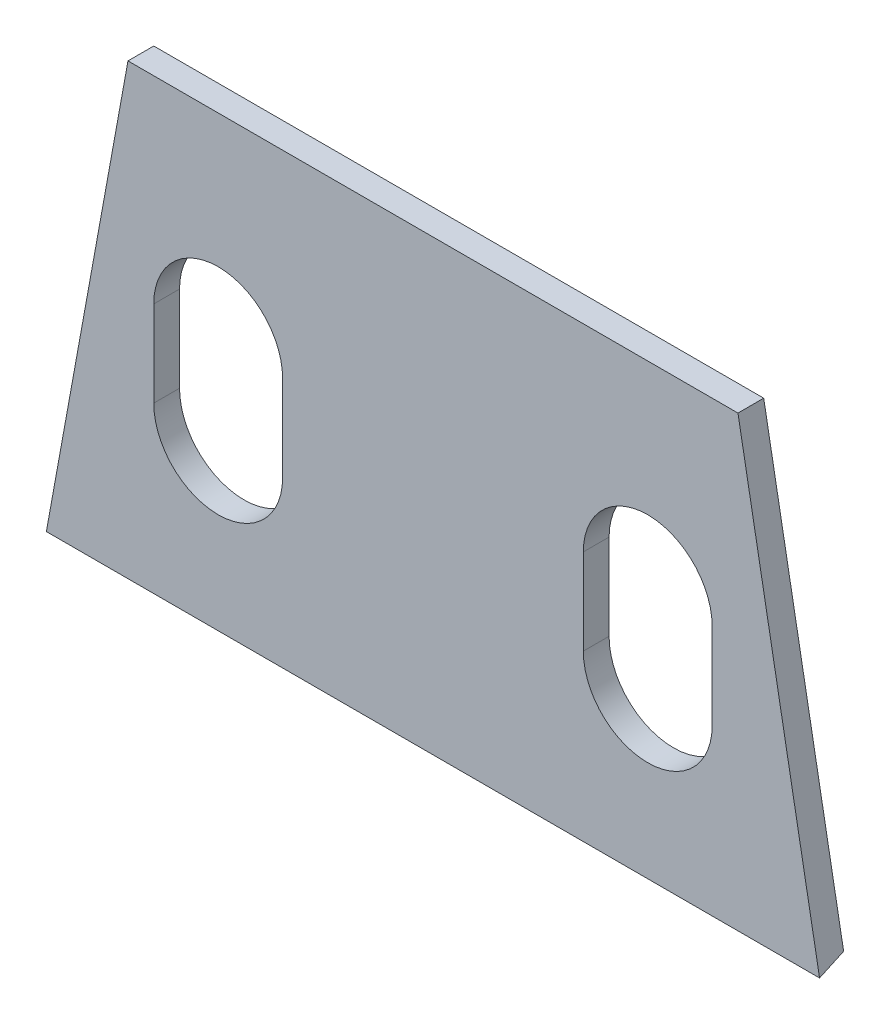
from build123d import *

# Parameters (mm, degrees)
BOSS_EXTRUDE1_DEPTH = 1.5
CUT_EXTRUDE1_DEPTH  = 69.98434605
CHAMFER1_SIZE2      = 1.091910703
CHAMFER1_SIZE       = 3


with BuildPart() as part:
    # Sketch1 → Boss-Extrude1 (new, symmetric)
    with BuildSketch(Plane.XY):
        Polygon((-45, 0), (45, 0), (35.5, 52.2), (-35.5, 52.2), align=None)
    extrude(amount=BOSS_EXTRUDE1_DEPTH, both=True)

    # Sketch2 → Cut-Extrude1 (cut, through all)
    with BuildSketch(Plane.XY.offset(1.5)):
        with BuildLine():
            Line((-17.5, 29.2), (-17.5, 19.2))
            ThreePointArc((-17.5, 19.2), (-25, 11.7), (-32.5, 19.2))
            Line((-32.5, 19.2), (-32.5, 29.2))
            ThreePointArc((-32.5, 29.2), (-25, 36.7), (-17.5, 29.2))
        make_face()
        with BuildLine():
            Line((17.5, 29.2), (17.5, 19.2))
            ThreePointArc((17.5, 19.2), (25, 11.7), (32.5, 19.2))
            Line((32.5, 19.2), (32.5, 29.2))
            ThreePointArc((32.5, 29.2), (25, 36.7), (17.5, 29.2))
        make_face()
    extrude(amount=-CUT_EXTRUDE1_DEPTH, mode=Mode.SUBTRACT)

    # Chamfer1
    chamfer1_edges = [part.edges().sort_by_distance(p)[0] for p in [
        (0, 0, -1.5),
    ]]
    chamfer1_side = [part.faces().sort_by_distance(p)[0] for p in [
        (0, 0, -1.478161786),
    ]]
    chamfer(chamfer1_edges, length=CHAMFER1_SIZE - 0.0001, length2=CHAMFER1_SIZE2 - 0.0001, reference=chamfer1_side[0])  # a hair under: the kernel refuses the full size


solid = part.part
